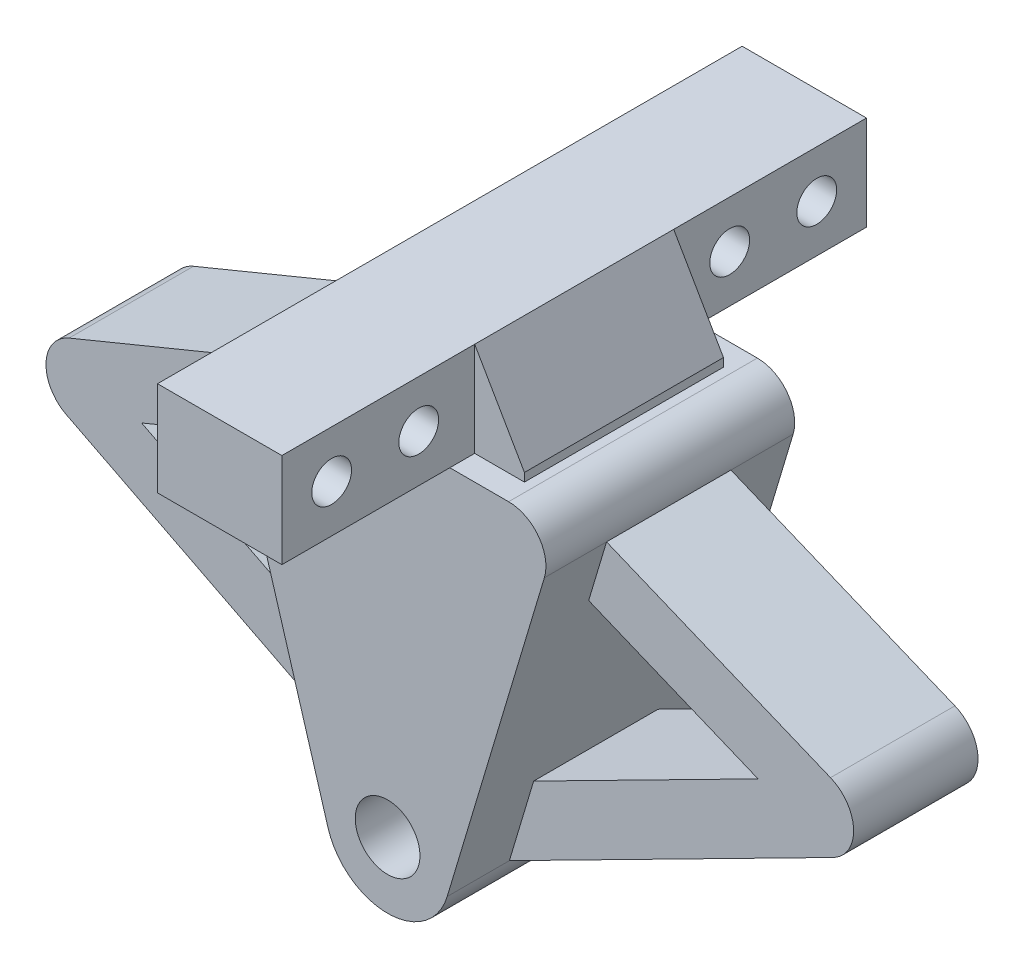
from build123d import *

# Parameters (mm, degrees)
SKETCH_1_W             = 47
SKETCH_1_H             = 7.6
SKETCH_1_R             = 1.6
EXTRUDE_1_DEPTH        = 5
SKETCH_4_W             = 4
SKETCH_4_H             = 7.6
EXTRUDE_3_DEPTH        = 8
SKETCH_3_R             = 2.6
EXTRUDE_2_DEPTH        = 10
FILLET_1_R             = 5
CHAMFER_1_SIZE         = 4
CHAMFER_1_SIZE2        = 6.92820323
FILLET_2_R             = 3
EXTRUDE_4_DEPTH        = 5
FILLET_3_R             = 3
FILLET_3_OF_MIRROR_1_R = 3


with BuildPart() as part:
    # 草图1 → 凸台-拉伸1 (new, symmetric)
    with BuildSketch(Plane(origin=(0, 0, 0), x_dir=(0, 0, -1), z_dir=(1, 0, 0))):
        Rectangle(SKETCH_1_W, SKETCH_1_H)
        with Locations((-19.5, 0)):
            Circle(SKETCH_1_R, mode=Mode.SUBTRACT)
        with Locations((-12.5, 0)):
            Circle(SKETCH_1_R, mode=Mode.SUBTRACT)
        with Locations((12.5, 0)):
            Circle(SKETCH_1_R, mode=Mode.SUBTRACT)
        with Locations((19.5, 0)):
            Circle(SKETCH_1_R, mode=Mode.SUBTRACT)
    extrude(amount=EXTRUDE_1_DEPTH, both=True)

    # 草图4 → 凸台-拉伸3 (add, symmetric)
    with BuildSketch(Plane.XY):
        with Locations((7, 0)):
            Rectangle(SKETCH_4_W, SKETCH_4_H)
        with Locations((-7, 0)):
            Rectangle(SKETCH_4_W, SKETCH_4_H)
    extrude(amount=EXTRUDE_3_DEPTH, both=True)

    # 草图3 → 凸台-拉伸2 (add, symmetric)
    with BuildSketch(Plane.XY):
        Polygon((0, -3.8), (-13.756900678, -3.8), (0, -49.766728974), (13.756900678, -3.8), align=None)
        with Locations((0, -32.020277262)):
            Circle(SKETCH_3_R, mode=Mode.SUBTRACT)
    extrude(amount=EXTRUDE_2_DEPTH, both=True)

    # 圆角1
    fillet_1_edges = [part.edges().sort_by_distance(p)[0] for p in [
        (0, -49.766728974, 0),
    ]]
    fillet(fillet_1_edges, radius=FILLET_1_R)

    # 倒角1
    chamfer_1_edges = [part.edges().sort_by_distance(p)[0] for p in [
        (-9, 3.8, 0),
        (9, 3.8, 0),
    ]]
    chamfer_1_side = [part.faces().sort_by_distance(p)[0] for p in [
        (0, 3.8, 0),
    ]]
    chamfer(chamfer_1_edges, length=CHAMFER_1_SIZE, length2=CHAMFER_1_SIZE2, reference=chamfer_1_side[0])

    # 圆角2
    fillet_2_edges = [part.edges().sort_by_distance(p)[0] for p in [
        (-13.756900678, -3.8, 0),
        (13.756900678, -3.8, 0),
    ]]
    fillet(fillet_2_edges, radius=FILLET_2_R)

    # 草图5 → 凸台-拉伸4 (add, symmetric)
    with BuildSketch(Plane.XY):
        Polygon((-12.6016387, -7.660143754), (-36.64770265, -17.562543764), (-4.790080237, -33.761356459), (-6.740083912, -27.245696244), (-24.782770498, -18.071436573), (-11.164189994, -12.463174365), align=None)
    extrude_4 = extrude(amount=EXTRUDE_4_DEPTH, both=True)

    # 圆角3
    fillet_3_edges = [part.edges().sort_by_distance(p)[0] for p in [
        (-36.64770265, -17.562543764, 0),
    ]]
    fillet(fillet_3_edges, radius=FILLET_3_R)

    # 镜向1: 凸台-拉伸4 across plane
    add(extrude_4.mirror(Plane(origin=(0, 0, 0), x_dir=(0, 0, 1), z_dir=(1, 0, 0))))

    # 圆角3 of 镜向1
    fillet_3_of_mirror_1_edges = [part.edges().sort_by_distance(p)[0] for p in [
        (36.64770265, -17.562543764, 0),
    ]]
    fillet(fillet_3_of_mirror_1_edges, radius=FILLET_3_OF_MIRROR_1_R)


solid = part.part
